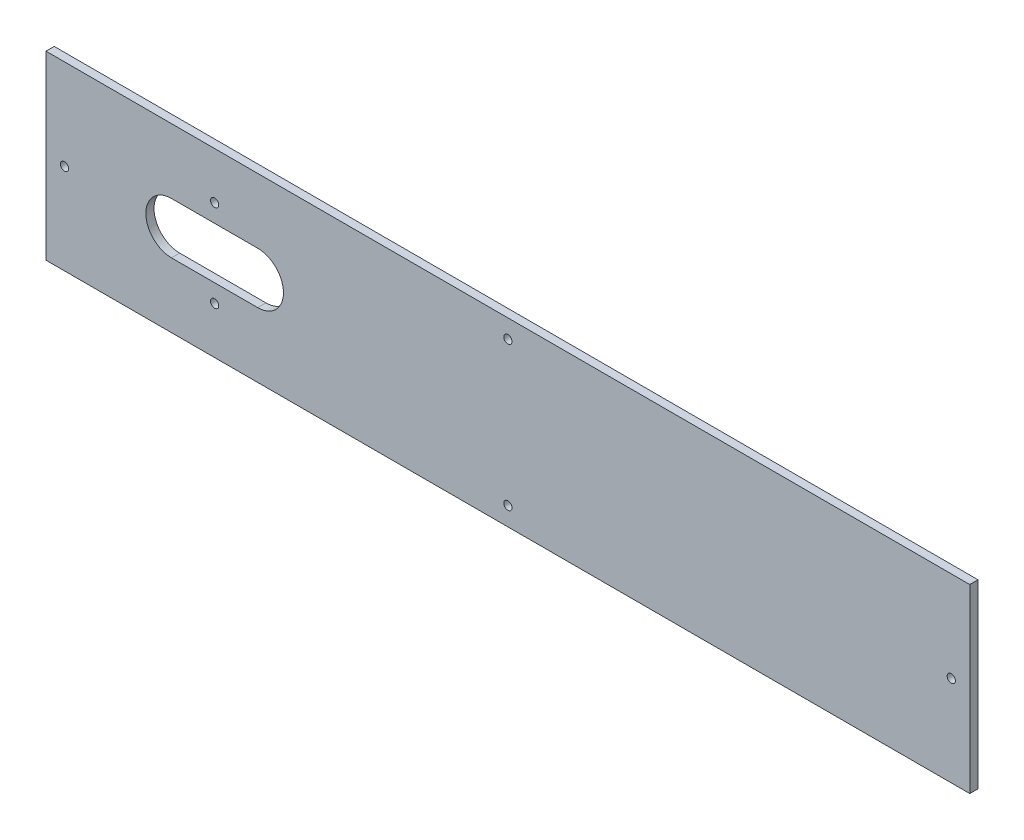
from build123d import *

# Parameters (mm, degrees)
SCHIZZO1_W                   = 449
SCHIZZO1_H                   = 88
SCHIZZO1_R                   = 2
ESTRUSIONE_ESTRUSIONE1_DEPTH = 4


with BuildPart() as part:
    # Schizzo1 → Estrusione-Estrusione1 (new body)
    with BuildSketch(Plane.XY):
        with Locations((-224.5, 44)):
            Rectangle(SCHIZZO1_W, SCHIZZO1_H)
        with Locations((-9, 44)):
            Circle(SCHIZZO1_R, mode=Mode.SUBTRACT)
        with Locations((-224.5, 79)):
            Circle(SCHIZZO1_R, mode=Mode.SUBTRACT)
        with Locations((-440, 44)):
            Circle(SCHIZZO1_R, mode=Mode.SUBTRACT)
        with Locations((-224.5, 9)):
            Circle(SCHIZZO1_R, mode=Mode.SUBTRACT)
        with Locations((-367.034119736, 65.209970787)):
            Circle(SCHIZZO1_R, mode=Mode.SUBTRACT)
        with Locations((-367.034119736, 22.790029213)):
            Circle(SCHIZZO1_R, mode=Mode.SUBTRACT)
        with BuildLine():
            Line((-387.978760649, 56.5), (-346.089478823, 56.5))
            ThreePointArc((-346.089478823, 56.5), (-333.589478823, 44), (-346.089478823, 31.5))
            Line((-346.089478823, 31.5), (-387.978760649, 31.5))
            ThreePointArc((-387.978760649, 31.5), (-400.478760649, 44), (-387.978760649, 56.5))
        make_face(mode=Mode.SUBTRACT)
    extrude(amount=ESTRUSIONE_ESTRUSIONE1_DEPTH)


solid = part.part
